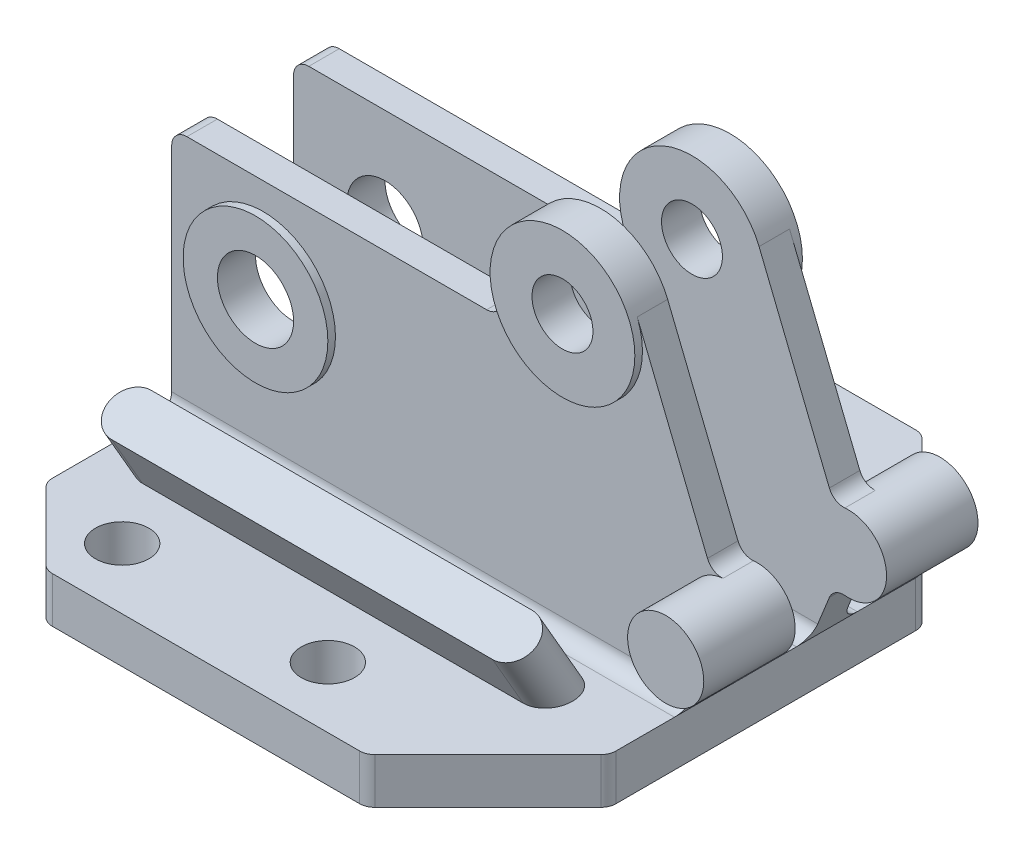
from build123d import *

# Parameters (mm, degrees)
SKETCH1_W           = 68
SKETCH1_H           = 36.5
BOSS_EXTRUDE1_DEPTH = 6
SKETCH2_R           = 3.5
CUT_EXTRUDE1_DEPTH  = 78.409624725
SKETCH3_W           = 68
SKETCH3_H           = 4
BOSS_EXTRUDE2_DEPTH = 1
SKETCH4_R           = 5
SKETCH4_R_2         = 4
BOSS_EXTRUDE3_DEPTH = 4
FILLET1_R           = 2
SKETCH5_R           = 9.5
SKETCH5_R_2         = 4
SKETCH5_R_3         = 5
BOSS_EXTRUDE4_DEPTH = 1
FILLET2_R           = 2
CHAMFER1_SIZE       = 10
CHAMFER2_SIZE       = 16
FILLET3_R           = 2
SKETCH7_R           = 5
BOSS_EXTRUDE6_DEPTH = 18
SKETCH8_W           = 25
SKETCH8_H           = 25
CUT_EXTRUDE2_DEPTH  = 12
FILLET8_R           = 2
BOSS_EXTRUDE8_REACH = 99.236


with BuildPart() as part:
    # Sketch1 → Boss-Extrude1 (new body)
    with BuildSketch(Plane(origin=(0, 0, 0), x_dir=(1, 0, 0), z_dir=(0, 1, 0))):
        with Locations((34, 18.25)):
            Rectangle(SKETCH1_W, SKETCH1_H)
    boss_extrude1 = extrude(amount=BOSS_EXTRUDE1_DEPTH)

    # Sketch2 → Cut-Extrude1 (cut, through all)
    with BuildSketch(Plane(origin=(0, 6, 0), x_dir=(1, 0, 0), z_dir=(0, 1, 0))):
        with Locations(Location((12, 28.5, 0), (0, 0, 270))):
            Circle(SKETCH2_R)
        with Locations(Location((39, 28.5, 0), (0, 0, 270))):
            Circle(SKETCH2_R)
    cut_extrude1 = extrude(amount=-CUT_EXTRUDE1_DEPTH, mode=Mode.SUBTRACT)

    # Sketch3 → Boss-Extrude2 (add)
    with BuildSketch(Plane(origin=(0, 6, 0), x_dir=(1, 0, 0), z_dir=(0, 1, 0))):
        with Locations((34, 8)):
            Rectangle(SKETCH3_W, SKETCH3_H)
    boss_extrude2 = extrude(amount=BOSS_EXTRUDE2_DEPTH)

    # Sketch4 → Boss-Extrude3 (add)
    with BuildSketch(Plane.XY.offset(-6)):
        with BuildLine():
            Line((68, 6), (72.84831471, 18))
            Line((72.84831471, 18), (61.107812514, 47.058762637))
            ThreePointArc((61.107812514, 47.058762637), (47.739148723, 51.833822365), (44.553599203, 38))
            Line((44.553599203, 38), (0, 38))
            Line((0, 38), (0, 6))
            Line((0, 6), (68, 6))
        make_face()
        with Locations((12, 25)):
            Circle(SKETCH4_R, mode=Mode.SUBTRACT)
        with Locations((52.299565896, 43.5)):
            Circle(SKETCH4_R_2, mode=Mode.SUBTRACT)
    boss_extrude3 = extrude(amount=-BOSS_EXTRUDE3_DEPTH)

    # Mirror1: Boss-Extrude1, Cut-Extrude1, Boss-Extrude2, Boss-Extrude3 across plane
    add(boss_extrude1.mirror(Plane.XY))
    add(cut_extrude1.mirror(Plane.XY), mode=Mode.SUBTRACT)
    add(boss_extrude2.mirror(Plane.XY))
    add(boss_extrude3.mirror(Plane.XY))

    # Fillet1
    fillet1_edges = [part.edges().sort_by_distance(p)[0] for p in [
        (34, 6, -6),
        (34, 6, -10),
        (34, 6, 6),
        (34, 6, 10),
    ]]
    fillet(fillet1_edges, radius=FILLET1_R)

    # Sketch5 → Boss-Extrude4 (add)
    # profile 1 of 2: a face of its own
    with BuildSketch(Plane.XY.offset(10)):
        with Locations(Location((52.299565896, 43.5, 0), (0, 0, 215.376540152))):
            Circle(SKETCH5_R)
        with Locations((52.299565896, 43.5)):
            Circle(SKETCH5_R_2, mode=Mode.SUBTRACT)
    # profile 2 of 2: a face of its own
    with BuildSketch(Plane.XY.offset(10)):
        with Locations((12, 25)):
            Circle(SKETCH5_R)
        with Locations((12, 25)):
            Circle(SKETCH5_R_3, mode=Mode.SUBTRACT)
    boss_extrude4 = extrude(amount=BOSS_EXTRUDE4_DEPTH)

    # Fillet2
    # the kernel refuses this fillet: 2 mm, written as the material it adds along each edge
    with BuildSketch(Plane(origin=(44.553599203, 38, -6), x_dir=(-0.4469432732557111, 0.8945623010676621, 0), z_dir=(0, 0, -1))) as fillet2_piece_1:
        with BuildLine():
            CenterArc((3.223135148, -1.976302693), FILLET2_R, 98.828804139, 107.718931873)
            Line((1.434010546, -2.870189239), (0, 0))
            ThreePointArc((0, 0), (1.458084948, -0.112562209), (2.916169896, 0))
        make_face()
    extrude(amount=4)
    with BuildSketch(Plane(origin=(44.553599203, 38, 6), x_dir=(-0.4469432732557111, 0.8945623010676621, 0), z_dir=(0, 0, 1))) as fillet2_piece_2:
        with BuildLine():
            CenterArc((3.223135148, 1.976302693), FILLET2_R, 153.452263987, 107.718931873)
            Line((1.434010546, 2.870189239), (0, 0))
            ThreePointArc((0, 0), (1.458084948, 0.112562209), (2.916169896, 0))
        make_face()
    extrude(amount=4)
    # the kernel refuses this fillet: 2 mm, written as the material it takes off along each edge
    with BuildSketch(Plane(origin=(0, 38, -1), x_dir=(0, -1, 0), z_dir=(0, 0, -1))) as fillet2_2_piece_1:
        with BuildLine():
            CenterArc((FILLET2_R, -FILLET2_R), FILLET2_R, 90, 90)
            Line((0, -FILLET2_R), (0, 0))
            Line((0, 0), (FILLET2_R, 0))
        make_face()
    extrude(amount=14, mode=Mode.SUBTRACT)
    with BuildSketch(Plane(origin=(0, 38, 1), x_dir=(0, -1, 0), z_dir=(0, 0, 1))) as fillet2_2_piece_2:
        with BuildLine():
            CenterArc((FILLET2_R, FILLET2_R), FILLET2_R, 180, 90)
            Line((0, FILLET2_R), (0, 0))
            Line((0, 0), (FILLET2_R, 0))
        make_face()
    extrude(amount=14, mode=Mode.SUBTRACT)

    # Chamfer1
    chamfer1_edges = [part.edges().sort_by_distance(p)[0] for p in [
        (0, 3, 36.5),
        (0, 3, -36.5),
    ]]
    chamfer(chamfer1_edges, length=CHAMFER1_SIZE)

    # Chamfer2
    chamfer2_edges = [part.edges().sort_by_distance(p)[0] for p in [
        (68, 3, 36.5),
        (68, 3, -36.5),
    ]]
    chamfer(chamfer2_edges, length=CHAMFER2_SIZE)

    # Fillet3
    fillet3_edges = [part.edges().sort_by_distance(p)[0] for p in [
        (10, 3, 36.5),
        (0, 3, -26.5),
        (0, 3, 26.5),
        (10, 3, -36.5),
        (68, 3, -20.5),
        (68, 3, 20.5),
        (52, 3, 36.5),
        (52, 3, -36.5),
    ]]
    fillet(fillet3_edges, radius=FILLET3_R)

    # Mirror2: Boss-Extrude4 across plane
    add(boss_extrude4.mirror(Plane.XY))

    # Sketch7 → Boss-Extrude6 (add, symmetric)
    with BuildSketch(Plane.XY):
        with Locations((72.84831471, 18)):
            Circle(SKETCH7_R)
    extrude(amount=BOSS_EXTRUDE6_DEPTH, both=True)

    # Sketch8 → Cut-Extrude2 (cut)
    with BuildSketch(Plane(origin=(0, 0, 6), x_dir=(-1, 0, 0), z_dir=(0, 0, -1))):
        with Locations((-70.130356493, 22.5)):
            Rectangle(SKETCH8_W, SKETCH8_H)
    extrude(amount=CUT_EXTRUDE2_DEPTH, mode=Mode.SUBTRACT)

    # Fillet8
    fillet8_edges = [part.edges().sort_by_distance(p)[0] for p in [
        (70.975281743, 22.635919273, 8),
        (70.975281743, 13.364080727, -8),
        (70.975281743, 22.635919273, -8),
        (70.975281743, 13.364080727, 8),
    ]]
    fillet(fillet8_edges, radius=FILLET8_R)

    # Boss-Extrude8: up to this plane
    boss_extrude8_end = Plane(origin=(0, 6, 0), z_dir=(0, 1, 0))
    # Sketch11 → Boss-Extrude8 (add, up to the surface)
    with BuildSketch(Plane(origin=(0, 20.304963619, 11.723076211), x_dir=(-1, 0, 0), z_dir=(0, 0.866025403784438, 0.500000000000001)), mode=Mode.PRIVATE) as boss_extrude8_sk1:
        with BuildLine():
            Line((-6.5, 8.609927238), (-56.5, 8.609927238))
            ThreePointArc((-56.5, 8.609927238), (-59.5, 11.609927238), (-56.5, 14.609927238))
            Line((-56.5, 14.609927238), (-6.5, 14.609927238))
            ThreePointArc((-6.5, 14.609927238), (-3.5, 11.609927238), (-6.5, 8.609927238))
        make_face()
    boss_extrude8_tool1 = split(extrude(boss_extrude8_sk1.sketch, amount=-BOSS_EXTRUDE8_REACH, mode=Mode.PRIVATE), bisect_by=boss_extrude8_end, keep=Keep.BOTH, mode=Mode.PRIVATE)
    add(boss_extrude8_tool1.solids().sort_by_distance((31.5, 14.5, 21.777568))[0])


solid = part.part
